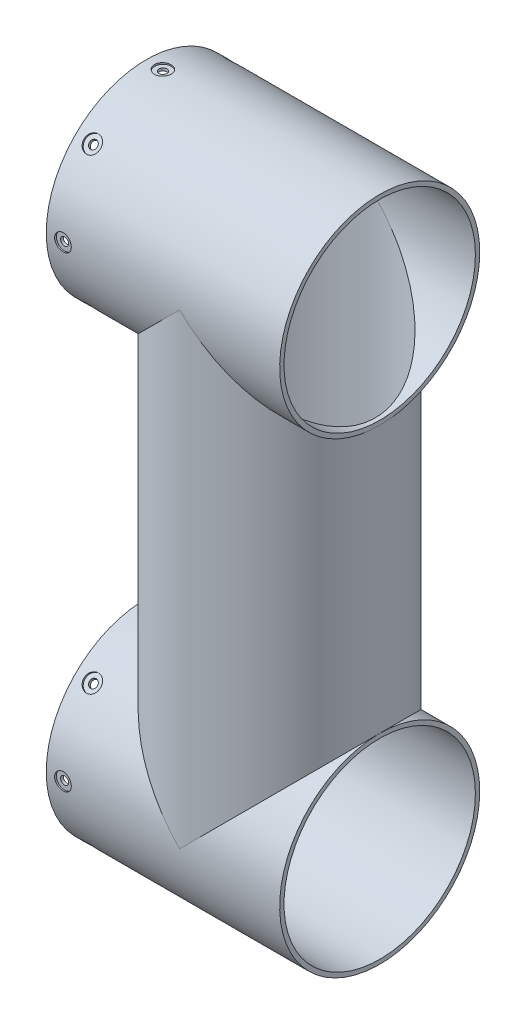
from build123d import *
from build123d.topology import SkipClean

# Parameters (mm, degrees)
SKETCH_1_R               = 30
EXTRUDE_1_DEPTH          = 140
EXTRUDE_START            = -40
SKETCH_2_R               = 30
EXTRUDE_2_DEPTH          = 70
SKETCH_3_R               = 28.7
CUT_EXTRUDE_1_DEPTH      = 160.373774505
PATTERN_CIRCULAR_1_COUNT = 8
SKETCH_4_R               = 28.7
CUT_EXTRUDE_2_DEPTH      = 140


with BuildPart() as part:
    # 스케치1 → 보스-돌출1 (new body)
    with BuildSketch(Plane(origin=(0, 0, 0), x_dir=(1, 0, 0), z_dir=(0, 1, 0))):
        Circle(SKETCH_1_R)
    extrude(amount=EXTRUDE_1_DEPTH)

    # 스케치2 → 보스-돌출2 (add)
    with SkipClean():  # the faces are left unmerged after this step: merging them gives an invalid solid
        with BuildSketch(Plane(origin=(0, 0, 0), x_dir=(0, 0, -1), z_dir=(1, 0, 0)).offset(EXTRUDE_START)):
            Circle(SKETCH_2_R)
        extrude_2 = extrude(amount=EXTRUDE_2_DEPTH)
    add(part.part.scale(1), mode=Mode.REPLACE)  # the faces are merged on a copy

    # 스케치3 → 컷-돌출1 (cut, through all)
    with BuildSketch(Plane(origin=(30, 0, 0), x_dir=(0, 0, -1), z_dir=(1, 0, 0))):
        Circle(SKETCH_3_R)
    cut_extrude_1 = extrude(amount=-CUT_EXTRUDE_1_DEPTH, mode=Mode.SUBTRACT)

    # 스케치7 → M2 남비 머리 나사용 카운터보어1 (revolve, cut)
    with BuildSketch(Plane(origin=(-35, 0, 30), x_dir=(0, -1, 0), z_dir=(1, 0, 0))):
        Polygon((0, 0), (0, 10.721032743), (1.2, 10), (1.2, 0.5), (2.5, 0.5), (2.5, 0), align=None)
    hole_wizard_m2_1 = revolve(axis=Axis((-35, 0, 36.35), (0, 0, -1)), mode=Mode.SUBTRACT)

    # 원형 패턴1: M2 남비 머리 나사용 카운터보어1 ×8 about axis
    pattern_circular_1_axis = Axis((-40, 0, 0), (1, 0, 0))
    for i in range(1, PATTERN_CIRCULAR_1_COUNT):
        add(hole_wizard_m2_1.rotate(pattern_circular_1_axis, i * 360 / PATTERN_CIRCULAR_1_COUNT), mode=Mode.SUBTRACT)

    # 대칭 복사2: 보스-돌출2, 컷-돌출1, M2 남비 머리 나사용 카운터보어1 across plane
    with SkipClean():  # the faces are left unmerged after this step: merging them gives an invalid solid
        add(extrude_2.mirror(Plane.ZX.offset(70)))
        add(cut_extrude_1.mirror(Plane.ZX.offset(70)), mode=Mode.SUBTRACT)
        add(hole_wizard_m2_1.mirror(Plane.ZX.offset(70)), mode=Mode.SUBTRACT)

    # 대칭 복사2 copy 1 sketch → 대칭 복사2 copy 1 (revolve, cut)
    with BuildSketch(Plane(origin=(-35, 161.213203436, 21.213203436), x_dir=(0, 0.7071067811865476, -0.7071067811865475), z_dir=(1, 0, 0))):
        Polygon((0, 0), (0, -10.721032743), (1.2, -10), (1.2, -0.5), (2.5, -0.5), (2.5, 0), align=None)
    revolve(axis=Axis((-35, 165.703331496, 25.703331496), (0, 0.7071067811865475, 0.7071067811865476)), mode=Mode.SUBTRACT)

    # 대칭 복사2 copy 2 sketch → 대칭 복사2 copy 2 (revolve, cut)
    with BuildSketch(Plane(origin=(-35, 170, 0), x_dir=(0, 0, -1), z_dir=(1, 0, 0))):
        Polygon((0, 0), (0, -10.721032743), (1.2, -10), (1.2, -0.5), (2.5, -0.5), (2.5, 0), align=None)
    revolve(axis=Axis((-35, 176.35, 0), (0, 1, 0)), mode=Mode.SUBTRACT)

    # 대칭 복사2 copy 3 sketch → 대칭 복사2 copy 3 (revolve, cut)
    with BuildSketch(Plane(origin=(-35, 161.213203436, -21.213203436), x_dir=(0, -0.7071067811865475, -0.7071067811865476), z_dir=(1, 0, 0))):
        Polygon((0, 0), (0, -10.721032743), (1.2, -10), (1.2, -0.5), (2.5, -0.5), (2.5, 0), align=None)
    revolve(axis=Axis((-35, 165.703331496, -25.703331496), (0, 0.7071067811865476, -0.7071067811865475)), mode=Mode.SUBTRACT)

    # 대칭 복사2 copy 4 sketch → 대칭 복사2 copy 4 (revolve, cut)
    with SkipClean():  # the faces are left unmerged after this step: merging them gives an invalid solid
        with BuildSketch(Plane(origin=(-35, 140, -30), x_dir=(0, -1, 0), z_dir=(1, 0, 0))):
            Polygon((0, 0), (0, -10.721032743), (1.2, -10), (1.2, -0.5), (2.5, -0.5), (2.5, 0), align=None)
        revolve(axis=Axis((-35, 140, -36.35), (0, 0, -1)), mode=Mode.SUBTRACT)

    # 대칭 복사2 copy 5 sketch → 대칭 복사2 copy 5 (revolve, cut)
    with BuildSketch(Plane(origin=(-35, 118.786796564, -21.213203436), x_dir=(0, -0.7071067811865477, 0.7071067811865475), z_dir=(1, 0, 0))):
        Polygon((0, 0), (0, -10.721032743), (1.2, -10), (1.2, -0.5), (2.5, -0.5), (2.5, 0), align=None)
    revolve(axis=Axis((-35, 114.296668504, -25.703331496), (0, -0.7071067811865475, -0.7071067811865477)), mode=Mode.SUBTRACT)

    # 대칭 복사2 copy 6 sketch → 대칭 복사2 copy 6 (revolve, cut)
    with BuildSketch(Plane(origin=(-35, 110, 0), x_dir=(0, 0, 1), z_dir=(1, 0, 0))):
        Polygon((0, 0), (0, -10.721032743), (1.2, -10), (1.2, -0.5), (2.5, -0.5), (2.5, 0), align=None)
    revolve(axis=Axis((-35, 103.65, 0), (0, -1, 0)), mode=Mode.SUBTRACT)

    # 대칭 복사2 copy 7 sketch → 대칭 복사2 copy 7 (revolve, cut)
    with BuildSketch(Plane(origin=(-35, 118.786796564, 21.213203436), x_dir=(0, 0.7071067811865474, 0.7071067811865477), z_dir=(1, 0, 0))):
        Polygon((0, 0), (0, -10.721032743), (1.2, -10), (1.2, -0.5), (2.5, -0.5), (2.5, 0), align=None)
    revolve(axis=Axis((-35, 114.296668504, 25.703331496), (0, -0.7071067811865477, 0.7071067811865474)), mode=Mode.SUBTRACT)

    # 스케치4 → 컷-돌출2 (cut)
    with BuildSketch(Plane(origin=(0, 140, 0), x_dir=(1, 0, 0), z_dir=(0, 1, 0))):
        Circle(SKETCH_4_R)
    extrude(amount=-CUT_EXTRUDE_2_DEPTH, mode=Mode.SUBTRACT)


solid = part.part
